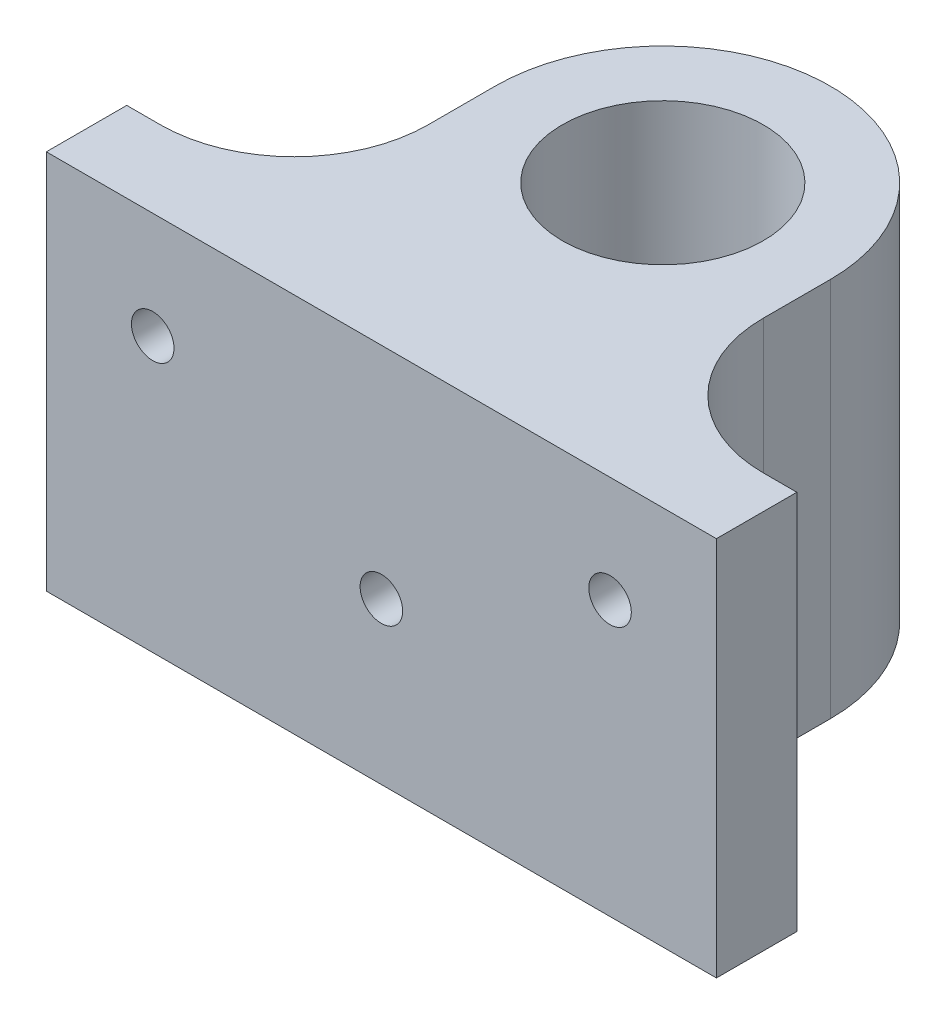
from build123d import *

# Parameters (mm, degrees)
PROFILE_SKETCH1_R                    = 7.5
PROFILE_BOSS_EXTRUDE2_DEPTH          = 28.390144
FASTENINGHOLESKETCH3_R               = 1.5875
FASTENINGHOLECUT_EXTRUDE8_DEPTH      = 51.529696975
LM8UUFASTENINGHOLESKETCH5_R          = 1.5875
LM8UUFASTENINGHOLECUT_EXTRUDE9_DEPTH = 51.529697031


with BuildPart() as part:
    # Profile-Sketch1 → Profile-Boss-Extrude2 (new body)
    with BuildSketch(Plane(origin=(0, 0, 0), x_dir=(1, 0, 0), z_dir=(0, 1, 0))):
        with BuildLine():
            Line((-25, -21), (25, -21))
            Line((25, -21), (25, -15))
            Line((25, -15), (22.5, -15))
            ThreePointArc((22.5, -15), (15.428932188, -12.071067812), (12.5, -5))
            Line((12.5, -5), (12.5, 0))
            ThreePointArc((12.5, 0), (0, 12.5), (-12.5, 0))
            Line((-12.5, 0), (-12.5, -5))
            ThreePointArc((-12.5, -5), (-15.428932188, -12.071067812), (-22.5, -15))
            Line((-22.5, -15), (-25, -15))
            Line((-25, -15), (-25, -21))
        make_face()
        Circle(PROFILE_SKETCH1_R, mode=Mode.SUBTRACT)
    extrude(amount=PROFILE_BOSS_EXTRUDE2_DEPTH)

    # FasteningHoleSketch3 → FasteningHoleCut-Extrude8 (cut, through all)
    with BuildSketch(Plane.XY.offset(21)):
        with Locations((-17.0625, 20.452644)):
            Circle(FASTENINGHOLESKETCH3_R)
        with Locations((17.0625, 20.452644)):
            Circle(FASTENINGHOLESKETCH3_R)
    extrude(amount=-FASTENINGHOLECUT_EXTRUDE8_DEPTH, mode=Mode.SUBTRACT)

    # LM8UUFasteningHoleSketch5 → LM8UUFasteningHoleCut-Extrude9 (cut, through all)
    with BuildSketch(Plane.XY.offset(21)):
        with Locations((0, 12)):
            Circle(LM8UUFASTENINGHOLESKETCH5_R)
    extrude(amount=-LM8UUFASTENINGHOLECUT_EXTRUDE9_DEPTH, mode=Mode.SUBTRACT)


solid = part.part
